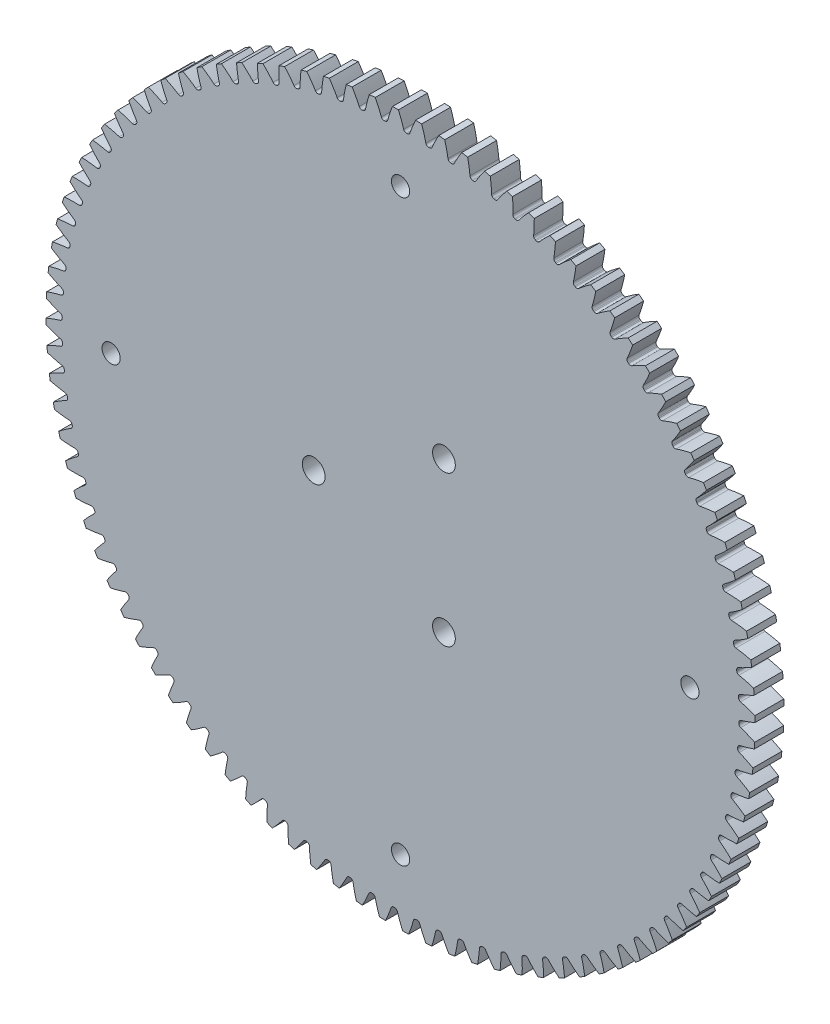
from build123d import *

# Parameters (mm, degrees)
SKETCH3_R          = 77.7875
GEARBODY_DEPTH     = 6.35
TOOTHCUT_DEPTH     = 111.191255608
CIRPATTERN1_COUNT  = 96
SKETCH4_R          = 2.499999953
CUT_EXTRUDE1_DEPTH = 111.189345242
SKETCH5_R          = 2.000000064
CUT_EXTRUDE2_DEPTH = 111.189345242


with BuildPart() as part:
    # Sketch3 → gearBody (new body)
    with BuildSketch(Plane.XY):
        Circle(SKETCH3_R)
    extrude(amount=GEARBODY_DEPTH)

    # Sketch2 → toothCut (cut, through all)
    with BuildSketch(Plane.XY):
        with BuildLine():
            ThreePointArc((74.229645105, -1.470041256), (74.231652244, -1.364931764), (74.233510549, -1.259819536))
            ThreePointArc((74.233510549, -1.259819536), (74.357469475, -0.900065574), (74.669516207, -0.682314421))
            ThreePointArc((74.669516207, -0.682314421), (83.521868489, 3.746156538), (90.39842703, 10.865737887))
            ThreePointArc((90.39842703, 10.865737887), (91.033719016, -1.673879146), (89.937868837, -14.181664866))
            ThreePointArc((89.937868837, -14.181664866), (83.327692223, -6.814096673), (74.644125506, -2.063184652))
            ThreePointArc((74.644125506, -2.063184652), (74.340294784, -1.834109074), (74.229645105, -1.470041256))
        make_face()
    toothcut = extrude(amount=TOOTHCUT_DEPTH, mode=Mode.SUBTRACT)

    # CirPattern1: toothCut ×96 about axis
    cirpattern1_axis = Axis((0, 0, 6.35), (0, 0, -1))
    for i in range(1, CIRPATTERN1_COUNT):
        add(toothcut.rotate(cirpattern1_axis, i * 360 / CIRPATTERN1_COUNT), mode=Mode.SUBTRACT)

    # Sketch4 → Cut-Extrude1 (cut, through all)
    with BuildSketch(Plane(origin=(0, 0, 0), x_dir=(-1, 0, 0), z_dir=(0, 0, -1))):
        with Locations((19.05, 0)):
            Circle(SKETCH4_R)
        with Locations((-9.525, -16.497783942)):
            Circle(SKETCH4_R)
        with Locations((-9.525, 16.497783942)):
            Circle(SKETCH4_R)
    extrude(amount=-CUT_EXTRUDE1_DEPTH, mode=Mode.SUBTRACT)

    # Sketch5 → Cut-Extrude2 (cut, through all)
    with BuildSketch(Plane(origin=(0, 0, 0), x_dir=(-1, 0, 0), z_dir=(0, 0, -1))):
        with Locations((63.5, 0)):
            Circle(SKETCH5_R)
        with Locations((0, -63.5)):
            Circle(SKETCH5_R)
        with Locations((-63.5, 0)):
            Circle(SKETCH5_R)
        with Locations((0, 63.5)):
            Circle(SKETCH5_R)
    extrude(amount=-CUT_EXTRUDE2_DEPTH, mode=Mode.SUBTRACT)


solid = part.part
